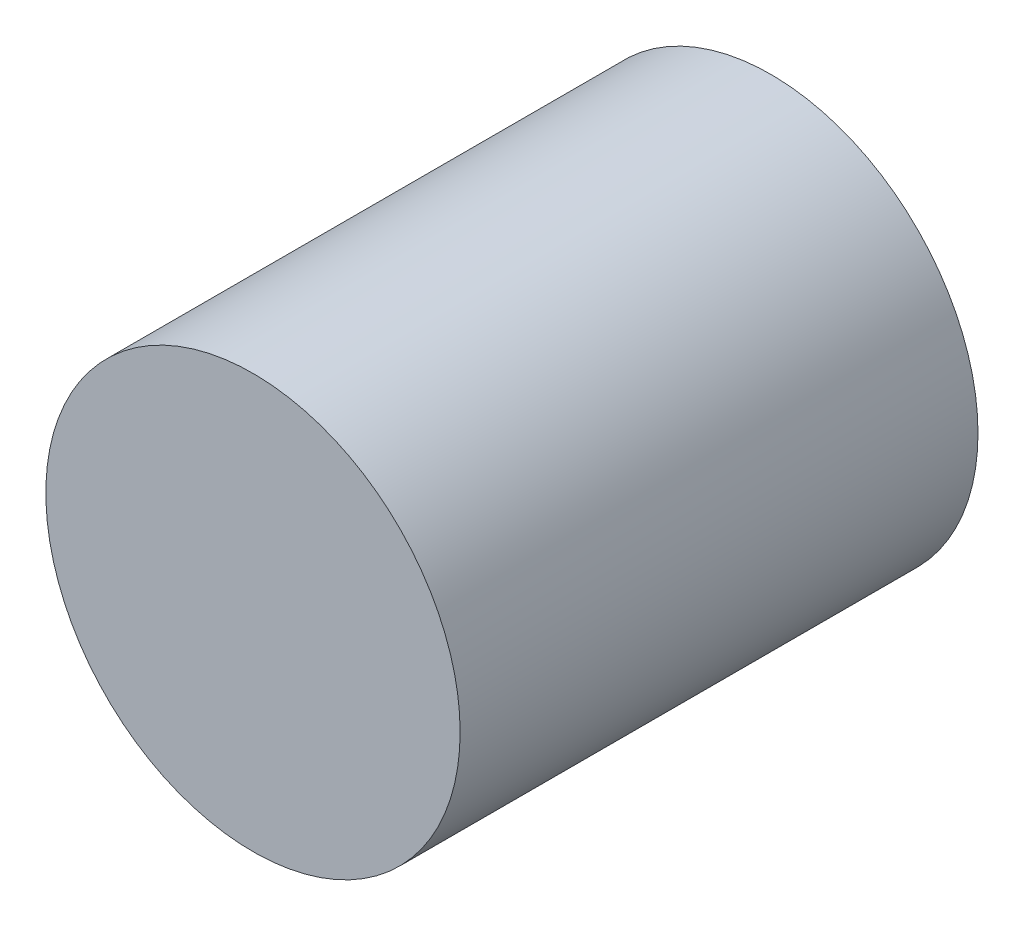
from build123d import *

# Parameters (mm, degrees)
SKETCH1_R           = 6
BOSS_EXTRUDE1_DEPTH = 15


with BuildPart() as part:
    # Sketch1 → Boss-Extrude1 (new body)
    with BuildSketch(Plane.XY):
        Circle(SKETCH1_R)
    extrude(amount=BOSS_EXTRUDE1_DEPTH)


solid = part.part
